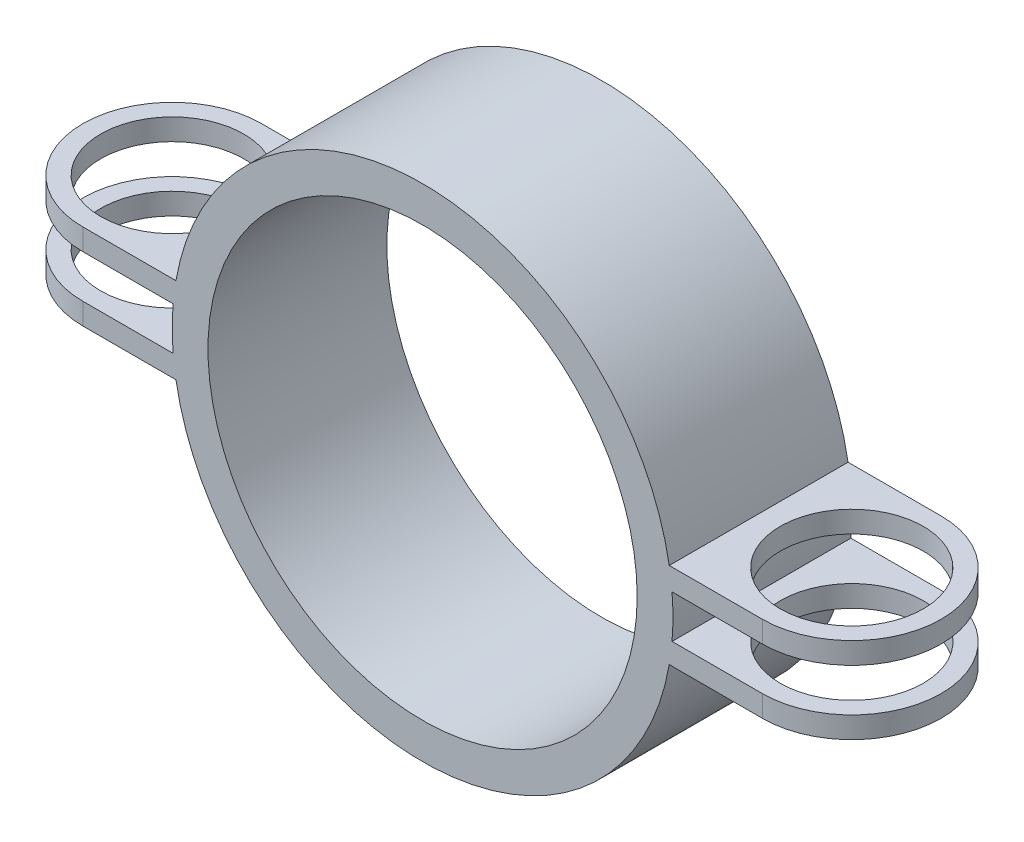
from build123d import *

# Parameters (mm, degrees)
TUBE_EXTRUDE_DEPTH                                  = 25
UPPER_START                                         = 3
PIN_RING_SKETCH_R                                   = 12.5
PIN_RING_SKETCH_R_2                                 = 10
UPPER_RIGHT_PIN_RING_EXTRUDE_DEPTH                  = 3
LOWER_START                                         = -3
PIN_RING_SKETCH_2_R                                 = 12.5
PIN_RING_SKETCH_2_R_2                               = 10
LOWER_RIGHT_PIN_RING_EXTRUDE_DEPTH                  = 3
UPPER_RIGHT_RING_CONNECTION_EXTRUDE_REACH           = 57.453
UPPER_RIGHT_RING_CONNECTION_EXTRUDE_END_RADIUS      = 35
UPPER_RIGHT_RING_CONNECTION_SKETCH_W                = 25
UPPER_RIGHT_RING_CONNECTION_SKETCH_H                = 3
UPPER_RIGHT_RING_CONNECTION_EXTRUDE_DIRE_REACH      = 57.453
UPPER_RIGHT_RING_CONNECTION_EXTRUDE_DIRE_END_RADIUS = 12.5
LOWER_RIGHT_RING_CONNECTION_EXTRUDE_REACH           = 57.453
LOWER_RIGHT_RING_CONNECTION_EXTRUDE_END_RADIUS      = 35
LOWER_RIGHT_RING_CONNECTION_SKETCH_W                = 25
LOWER_RIGHT_RING_CONNECTION_SKETCH_H                = 3
LOWER_RIGHT_RING_CONNECTION_EXTRUDE_DIRE_REACH      = 57.453
LOWER_RIGHT_RING_CONNECTION_EXTRUDE_DIRE_END_RADIUS = 12.5
FAULTY_START                                        = -35
FAULTY_MIRROR_DEPTH                                 = 70
FAULTY_START_2                                      = -25
FAULTY_MIRROR_2_DEPTH                               = 25
MIRROR_HACK_CUT_REACH                               = 78.851
MIRROR_HACK_SKETCH_R                                = 10


with BuildPart() as part:
    # Tube Sketch → Tube Extrude (new body)
    with BuildSketch(Plane.XY):
        with BuildLine():
            Line((0, 35), (0, 30))
            ThreePointArc((0, 30), (-30, 0), (0, -30))
            Line((0, -30), (0, -35))
            ThreePointArc((0, -35), (-35, 0), (0, 35))
        make_face()
    extrude(amount=-TUBE_EXTRUDE_DEPTH)



with BuildPart() as body_2:
    # Pin Ring Sketch → Upper Right Pin Ring Extrude (new body)
    with BuildSketch(Plane(origin=(0, 0, 0), x_dir=(1, 0, 0), z_dir=(0, 1, 0)).offset(UPPER_START)):
        with Locations(Location((-47.5, 12.5, 0), (0, 0, 270))):
            Circle(PIN_RING_SKETCH_R)
        with Locations(Location((-47.5, 12.5, 0), (0, 0, 270))):
            Circle(PIN_RING_SKETCH_R_2, mode=Mode.SUBTRACT)
    extrude(amount=UPPER_RIGHT_PIN_RING_EXTRUDE_DEPTH)


with BuildPart() as body_3:
    # Pin Ring Sketch<2> → Lower Right Pin Ring Extrude (new body)
    with BuildSketch(Plane(origin=(0, 0, 0), x_dir=(1, 0, 0), z_dir=(0, 1, 0)).offset(LOWER_START)):
        with Locations(Location((-47.5, 12.5, 0), (0, 0, 270))):
            Circle(PIN_RING_SKETCH_2_R)
        with Locations(Location((-47.5, 12.5, 0), (0, 0, 270))):
            Circle(PIN_RING_SKETCH_2_R_2, mode=Mode.SUBTRACT)
    extrude(amount=-LOWER_RIGHT_PIN_RING_EXTRUDE_DEPTH)


with BuildPart() as part_1:
    add(part.part)

    add(body_2.part)  # Upper Right Ring Connection Extrude merges body 2
    # Upper Right Ring Connection Extrude: up to this cylinder (the profile starts outside it)
    upper_right_ring_connection_extrude_end = Plane(origin=(0, 0, -12.5), z_dir=(0, 0, 1)) * Cylinder(UPPER_RIGHT_RING_CONNECTION_EXTRUDE_END_RADIUS, 185.906, mode=Mode.PRIVATE)
    # Upper Right Ring Connection Sketch → Upper Right Ring Connection Extrude (add, up to the surface)
    with BuildSketch(Plane.ZY.offset(35), mode=Mode.PRIVATE) as upper_right_ring_connection_extrude_sk1:
        with Locations((-12.5, 4.5)):
            Rectangle(UPPER_RIGHT_RING_CONNECTION_SKETCH_W, UPPER_RIGHT_RING_CONNECTION_SKETCH_H)
    upper_right_ring_connection_extrude_tool1 = extrude(upper_right_ring_connection_extrude_sk1.sketch, amount=-UPPER_RIGHT_RING_CONNECTION_EXTRUDE_REACH, mode=Mode.PRIVATE) - upper_right_ring_connection_extrude_end
    add(upper_right_ring_connection_extrude_tool1.solids().sort_by_distance((-35, 4.5, -12.5))[0])

    # Upper Right Ring Connection Extrude dire: up to this cylinder (the profile starts outside it)
    upper_right_ring_connection_extrude_dire_end = Plane(origin=(-47.5, 4.5, -12.5), z_dir=(0, -1, 0)) * Cylinder(UPPER_RIGHT_RING_CONNECTION_EXTRUDE_DIRE_END_RADIUS, 140.906, mode=Mode.PRIVATE)
    # Upper Right Ring Connection Sketch → Upper Right Ring Connection Extrude dire (add, up to the surface)
    with BuildSketch(Plane.ZY.offset(35), mode=Mode.PRIVATE) as upper_right_ring_connection_extrude_dire_sk1:
        with Locations((-12.5, 4.5)):
            Rectangle(UPPER_RIGHT_RING_CONNECTION_SKETCH_W, UPPER_RIGHT_RING_CONNECTION_SKETCH_H)
    upper_right_ring_connection_extrude_dire_tool1 = extrude(upper_right_ring_connection_extrude_dire_sk1.sketch, amount=UPPER_RIGHT_RING_CONNECTION_EXTRUDE_DIRE_REACH, mode=Mode.PRIVATE) - upper_right_ring_connection_extrude_dire_end
    add(upper_right_ring_connection_extrude_dire_tool1.solids().sort_by_distance((-35, 4.5, -12.5))[0])
    add(upper_right_ring_connection_extrude_dire_tool1.solids().sort_by_distance((-35, 4.5, -12.5))[1])


    add(body_3.part)  # Lower Right Ring Connection Extrude merges body 3
    # Lower Right Ring Connection Extrude: up to this cylinder (the profile starts outside it)
    lower_right_ring_connection_extrude_end = Plane(origin=(0, 0, -12.5), z_dir=(0, 0, 1)) * Cylinder(LOWER_RIGHT_RING_CONNECTION_EXTRUDE_END_RADIUS, 185.906, mode=Mode.PRIVATE)
    # Lower Right Ring Connection Sketch → Lower Right Ring Connection Extrude (add, up to the surface)
    with BuildSketch(Plane.ZY.offset(35), mode=Mode.PRIVATE) as lower_right_ring_connection_extrude_sk1:
        with Locations((-12.5, -4.5)):
            Rectangle(LOWER_RIGHT_RING_CONNECTION_SKETCH_W, LOWER_RIGHT_RING_CONNECTION_SKETCH_H)
    lower_right_ring_connection_extrude_tool1 = extrude(lower_right_ring_connection_extrude_sk1.sketch, amount=-LOWER_RIGHT_RING_CONNECTION_EXTRUDE_REACH, mode=Mode.PRIVATE) - lower_right_ring_connection_extrude_end
    add(lower_right_ring_connection_extrude_tool1.solids().sort_by_distance((-35, -4.5, -12.5))[0])

    # Lower Right Ring Connection Extrude dire: up to this cylinder (the profile starts outside it)
    lower_right_ring_connection_extrude_dire_end = Plane(origin=(-47.5, -4.5, -12.5), z_dir=(0, 1, 0)) * Cylinder(LOWER_RIGHT_RING_CONNECTION_EXTRUDE_DIRE_END_RADIUS, 140.906, mode=Mode.PRIVATE)
    # Lower Right Ring Connection Sketch → Lower Right Ring Connection Extrude dire (add, up to the surface)
    with BuildSketch(Plane.ZY.offset(35), mode=Mode.PRIVATE) as lower_right_ring_connection_extrude_dire_sk1:
        with Locations((-12.5, -4.5)):
            Rectangle(LOWER_RIGHT_RING_CONNECTION_SKETCH_W, LOWER_RIGHT_RING_CONNECTION_SKETCH_H)
    lower_right_ring_connection_extrude_dire_tool1 = extrude(lower_right_ring_connection_extrude_dire_sk1.sketch, amount=LOWER_RIGHT_RING_CONNECTION_EXTRUDE_DIRE_REACH, mode=Mode.PRIVATE) - lower_right_ring_connection_extrude_dire_end
    add(lower_right_ring_connection_extrude_dire_tool1.solids().sort_by_distance((-35, -4.5, -12.5))[0])
    add(lower_right_ring_connection_extrude_dire_tool1.solids().sort_by_distance((-35, -4.5, -12.5))[1])

    # Faulty Mirror: read off the stored shape, not the designer's step
    # Faulty Mirror outline → Faulty Mirror (add)
    with BuildSketch(Plane(origin=(0, 0, 0), x_dir=(1, 0, 0), z_dir=(0, 1, 0)).offset(FAULTY_START)):
        with BuildLine():
            Line((47.5, 25), (0, 25))
            Line((0, 25), (0, 0))
            Line((0, 0), (47.5, 0))
            ThreePointArc((47.5, 0), (60, 12.5), (47.5, 25))
        make_face()
    extrude(amount=FAULTY_MIRROR_DEPTH)

    # Faulty Mirror 2 outline → Faulty Mirror 2 (cut)
    with BuildSketch(Plane.XY.offset(FAULTY_START_2)):
        with BuildLine():
            ThreePointArc((34.871191548, 3), (35, 0), (34.871191548, -3))
            Line((34.871191548, -3), (61, -3))
            Line((61, -3), (61, 3))
            Line((61, 3), (34.871191548, 3))
        make_face()
        with BuildLine():
            Line((61, -35), (61, -6))
            Line((61, -6), (34.481879299, -6))
            ThreePointArc((34.481879299, -6), (22.527760652, -26.786190472), (0, -35))
            Line((0, -35), (61, -35))
        make_face()
        with BuildLine():
            Line((34.481879299, 6), (61, 6))
            Line((61, 6), (61, 35))
            Line((61, 35), (0, 35))
            ThreePointArc((0, 35), (22.527760652, 26.786190472), (34.481879299, 6))
        make_face()
        with BuildLine():
            Line((0, 30), (0, -30))
            ThreePointArc((0, -30), (30, 0), (0, 30))
        make_face()
    extrude(amount=FAULTY_MIRROR_2_DEPTH, mode=Mode.SUBTRACT)

    # Mirror Hack Cut: up to this face of the body (flat: up to its plane)
    mirror_hack_cut_end = Plane(part_1.part.faces().sort_by_distance((46.070109689, -6, -12.5))[0])
    # Mirror Hack Sketch → Mirror Hack Cut (cut, up to the picked face)
    with BuildSketch(Plane(origin=(0, 6, 0), x_dir=(1, 0, 0), z_dir=(0, 1, 0)), mode=Mode.PRIVATE) as mirror_hack_cut_sk1:
        with Locations(Location((47.5, 12.5, 0), (0, 0, 270))):
            Circle(MIRROR_HACK_SKETCH_R)
    mirror_hack_cut_tool1 = split(extrude(mirror_hack_cut_sk1.sketch, amount=-MIRROR_HACK_CUT_REACH, mode=Mode.PRIVATE), bisect_by=mirror_hack_cut_end, keep=Keep.BOTH, mode=Mode.PRIVATE)
    add(mirror_hack_cut_tool1.solids().sort_by(Axis((47.5, 6, -12.5), (0, -1, 0)))[0], mode=Mode.SUBTRACT)


solid = part_1.part
